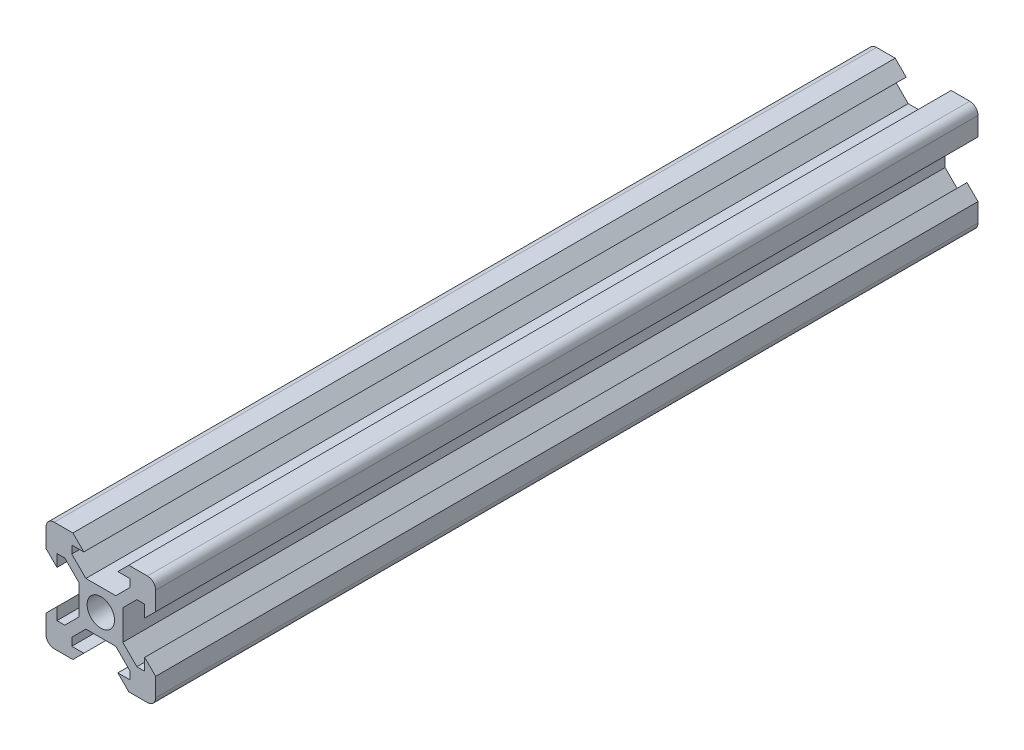
from build123d import *

# Parameters (mm, degrees)
SKETCH_1_R      = 2.5
EXTRUDE_1_DEPTH = 150
FILLET_1_R      = 1.5


with BuildPart() as part:
    # Эскиз1 → Бобышка-Вытянуть1 (new body)
    with BuildSketch(Plane.XY):
        Polygon((-2.727207794, 4), (2.727207794, 4), (5.3, 6.572792206), (5.3, 8), (3.1, 8), (5.1, 10), (10, 10), (10, 5.1), (8, 3.1), (8, 5.3), (6.572792206, 5.3), (4, 2.727207794), (4, -2.727207794), (6.572792206, -5.3), (8, -5.3), (8, -3.1), (10, -5.1), (10, -10), (5.1, -10), (3.1, -8), (5.3, -8), (5.3, -6.572792206), (2.727207794, -4), (-2.727207794, -4), (-5.3, -6.572792206), (-5.3, -8), (-3.1, -8), (-5.1, -10), (-10, -10), (-10, -5.1), (-8, -3.1), (-8, -5.3), (-6.572792206, -5.3), (-4, -2.727207794), (-4, 2.727207794), (-6.572792206, 5.3), (-8, 5.3), (-8, 3.1), (-10, 5.1), (-10, 10), (-5.1, 10), (-3.1, 8), (-5.3, 8), (-5.3, 6.572792206), align=None)
        Circle(SKETCH_1_R, mode=Mode.SUBTRACT)
    extrude(amount=EXTRUDE_1_DEPTH)

    # Скругление1
    fillet_1_edges = [part.edges().sort_by_distance(p)[0] for p in [
        (-10, -10, 75),
        (10, -10, 75),
        (10, 10, 75),
        (-10, 10, 75),
    ]]
    fillet(fillet_1_edges, radius=FILLET_1_R)


solid = part.part
